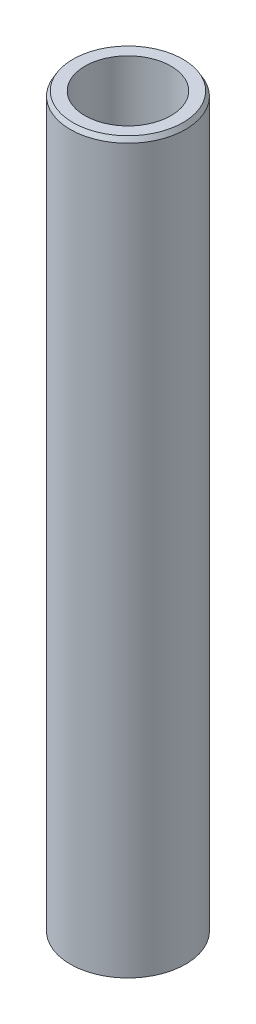
from build123d import *
from OCP.BRepFilletAPI import BRepFilletAPI_MakeChamfer

# Parameters (mm, degrees)
SKETCH1_R           = 12.5
BOSS_EXTRUDE1_DEPTH = 158.355854702
SKETCH2_R           = 9.322652516
CUT_EXTRUDE1_DEPTH  = 160.339501438
CHAMFER1_SIZE       = 0.998984829
CHAMFER1_SIZE2      = 0.57676416


with BuildPart() as part:
    # Sketch1 → Boss-Extrude1 (new body)
    with BuildSketch(Plane(origin=(0, 0, 0), x_dir=(1, 0, 0), z_dir=(0, 1, 0))):
        Circle(SKETCH1_R)
    extrude(amount=BOSS_EXTRUDE1_DEPTH)

    # Sketch2 → Cut-Extrude1 (cut, through all)
    with BuildSketch(Plane(origin=(0, 0, 0), x_dir=(1, 0, 0), z_dir=(0, 1, 0))):
        Circle(SKETCH2_R)
    extrude(amount=CUT_EXTRUDE1_DEPTH, mode=Mode.SUBTRACT)

    # Chamfer1: one chamfer whose edges measure the first distance from different faces: ONE call of the kernel's chamfer builder (chamfer() names one face for all edges)
    chamfer1_edges_1 = [part.edges().sort_by_distance(p)[0] for p in [
        (-12.5, 158.355854702, 0),
    ]]
    chamfer1_side_1 = [part.faces().sort_by_distance(p)[0] for p in [
        (-12.5, 79.177927351, 0),
    ]]
    chamfer1_edges_2 = [part.edges().sort_by_distance(p)[0] for p in [
        (-12.5, 0, 0),
    ]]
    chamfer1_side_2 = [part.faces().sort_by_distance(p)[0] for p in [
        (-12.146446609, 0, 0),
    ]]
    chamfer1 = BRepFilletAPI_MakeChamfer(part.part.solid().wrapped)
    for e in chamfer1_edges_1:
        chamfer1.Add(CHAMFER1_SIZE, CHAMFER1_SIZE2, e.wrapped, chamfer1_side_1[0].wrapped)  # the first distance lies on this face
    for e in chamfer1_edges_2:
        chamfer1.Add(CHAMFER1_SIZE, CHAMFER1_SIZE2, e.wrapped, chamfer1_side_2[0].wrapped)  # the first distance lies on this face
    add(Compound.cast(chamfer1.Shape()), mode=Mode.REPLACE)


solid = part.part
